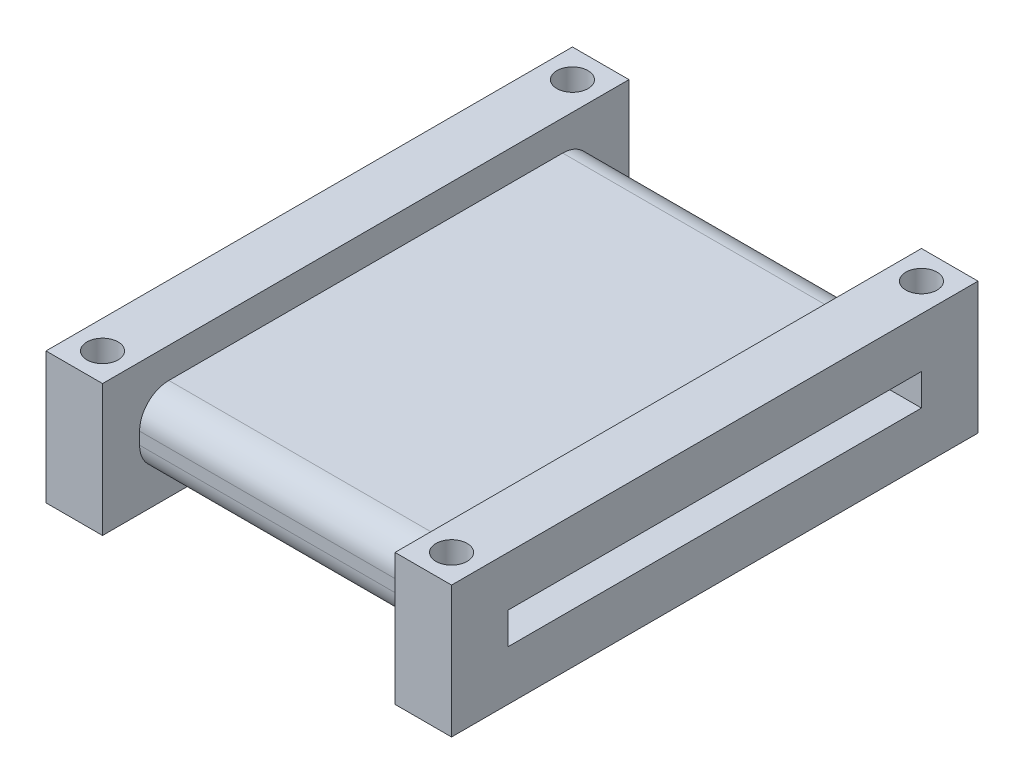
from build123d import *

# Parameters (mm, degrees)
SKETCH1_W           = 46.4
SKETCH1_H           = 7.25
SKETCH1_W_2         = 42.4
SKETCH1_H_2         = 3.25
BOSS_EXTRUDE1_DEPTH = 30
FILLET2_R           = 3
SKETCH2_W           = 54
SKETCH2_H           = 13.5
SKETCH2_W_2         = 42.4
SKETCH2_H_2         = 3.25
BOSS_EXTRUDE2_DEPTH = 5.8
SKETCH3_W           = 54
SKETCH3_H           = 13.5
SKETCH3_W_2         = 42.4
SKETCH3_H_2         = 3.25
BOSS_EXTRUDE3_DEPTH = 5.8
SKETCH4_R           = 1.6
CUT_EXTRUDE1_DEPTH  = 64.118380841


with BuildPart() as part:
    # Sketch1 → Boss-Extrude1 (new body)
    with BuildSketch(Plane(origin=(0, 0, 0), x_dir=(0, 0, -1), z_dir=(1, 0, 0))):
        with Locations((23.2, 3.625)):
            Rectangle(SKETCH1_W, SKETCH1_H)
        with Locations((23.2, 3.625)):
            Rectangle(SKETCH1_W_2, SKETCH1_H_2, mode=Mode.SUBTRACT)
    extrude(amount=BOSS_EXTRUDE1_DEPTH)

    # Fillet2
    fillet2_edges = [part.edges().sort_by_distance(p)[0] for p in [
        (15, 0, -46.4),
        (15, 0, 0),
        (15, 7.25, 0),
        (15, 7.25, -46.4),
    ]]
    fillet(fillet2_edges, radius=FILLET2_R)

    # Sketch2 → Boss-Extrude2 (add)
    with BuildSketch(Plane(origin=(30, 0, 0), x_dir=(0, 0, -1), z_dir=(1, 0, 0))):
        with Locations((23.2, 3.625)):
            Rectangle(SKETCH2_W, SKETCH2_H)
        with Locations((23.2, 3.625)):
            Rectangle(SKETCH2_W_2, SKETCH2_H_2, mode=Mode.SUBTRACT)
    extrude(amount=BOSS_EXTRUDE2_DEPTH)

    # Sketch3 → Boss-Extrude3 (add)
    with BuildSketch(Plane.ZY):
        with Locations((-23.2, 3.625)):
            Rectangle(SKETCH3_W, SKETCH3_H)
        with Locations((-23.2, 3.625)):
            Rectangle(SKETCH3_W_2, SKETCH3_H_2, mode=Mode.SUBTRACT)
    extrude(amount=BOSS_EXTRUDE3_DEPTH)

    # Sketch4 → Cut-Extrude1 (cut, through all)
    with BuildSketch(Plane(origin=(0, 10.375, 0), x_dir=(1, 0, 0), z_dir=(0, 1, 0))):
        with Locations((-2.9, 47.3)):
            Circle(SKETCH4_R)
        with Locations((32.9, 47.3)):
            Circle(SKETCH4_R)
        with Locations((-2.9, -0.9)):
            Circle(SKETCH4_R)
        with Locations((32.9, -0.9)):
            Circle(SKETCH4_R)
    extrude(amount=-CUT_EXTRUDE1_DEPTH, mode=Mode.SUBTRACT)


solid = part.part
